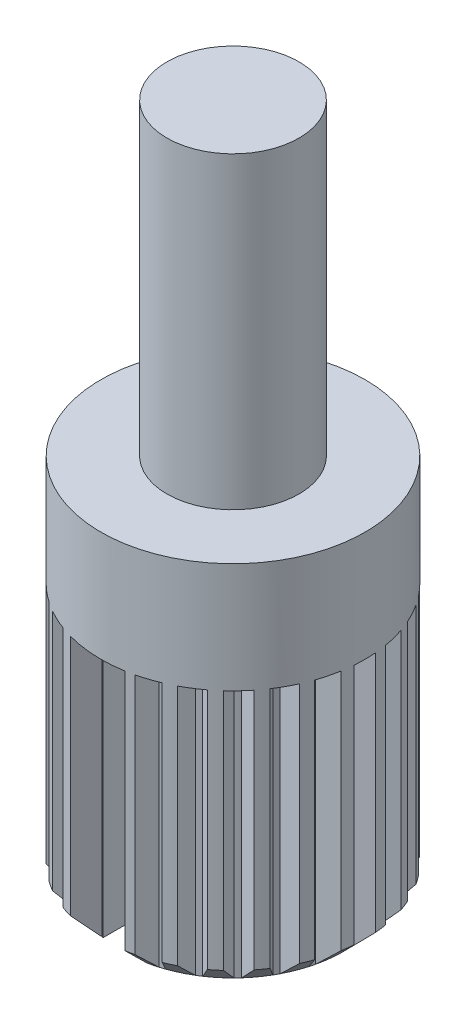
from build123d import *

# Parameters (mm, degrees)
CROQUIS1_R              = 1.5
SALIENTE_EXTRUIR1_DEPTH = 7
CROQUIS2_R              = 3
SALIENTE_EXTRUIR2_DEPTH = 8.5
CHAFL_N1_SIZE           = 0.5
CROQUIS3_W              = 1
CROQUIS3_H              = 7.172023087
CORTAR_EXTRUIR1_DEPTH   = 6
CORTAR_EXTRUIR5_DEPTH   = 6
MATRIZC1_COUNT          = 25


with BuildPart() as part:
    # Croquis1 → Saliente-Extruir1 (new body)
    with BuildSketch(Plane(origin=(0, 0, 0), x_dir=(1, 0, 0), z_dir=(0, 1, 0))):
        Circle(CROQUIS1_R)
    extrude(amount=SALIENTE_EXTRUIR1_DEPTH)

    # Croquis2 → Saliente-Extruir2 (add)
    with BuildSketch(Plane.XZ):
        Circle(CROQUIS2_R)
    extrude(amount=SALIENTE_EXTRUIR2_DEPTH)

    # Chaflán1
    chafl_n1_edges = [part.edges().sort_by_distance(p)[0] for p in [
        (-3, -8.5, 0),
    ]]
    chamfer(chafl_n1_edges, length=CHAFL_N1_SIZE)

    # Croquis3 → Cortar-Extruir1 (cut)
    with BuildSketch(Plane.XZ.offset(8.5)):
        with Locations((0, -0.228471649)):
            Rectangle(CROQUIS3_W, CROQUIS3_H)
    extrude(amount=-CORTAR_EXTRUIR1_DEPTH, mode=Mode.SUBTRACT)

    # Croquis4 → Cortar-Extruir5 (cut)
    with BuildSketch(Plane.XZ.offset(8.5)):
        with BuildLine():
            Line((3, 0.25), (2.49928007, 0.059992776))
            ThreePointArc((2.49928007, 0.059992776), (2.5, 0), (2.49928007, -0.059992776))
            Line((2.49928007, -0.059992776), (3, -0.25))
            ThreePointArc((3, -0.25), (3.25, 0), (3, 0.25))
        make_face()
    cortar_extruir5 = extrude(amount=-CORTAR_EXTRUIR5_DEPTH, mode=Mode.SUBTRACT)

    # MatrizC1: Cortar-Extruir5 ×25 about axis
    matrizc1_axis = Axis((0, -8.5, 0), (0, 1, 0))
    for i in range(1, MATRIZC1_COUNT):
        add(cortar_extruir5.rotate(matrizc1_axis, i * 360 / MATRIZC1_COUNT), mode=Mode.SUBTRACT)


solid = part.part
